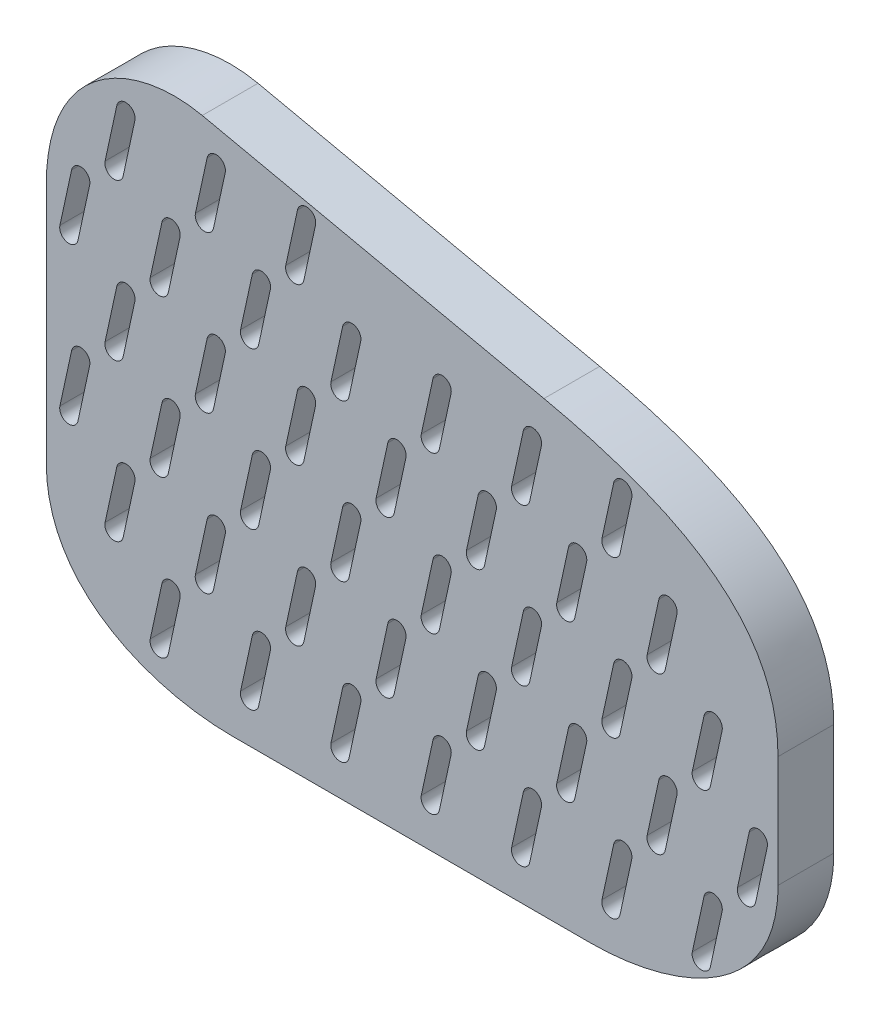
from build123d import *

# Parameters (mm, degrees)
EXTRUDE_1_DEPTH     = 10
CUT_EXTRUDE_1_DEPTH = 149.427210809
OTHER_1_DEPTH       = 10


# Read off the part's stored shape, not the designer's step: Образец заполнения1
with BuildPart() as part:
    # Эскиз1_fr → Бобышка-Вытянуть1 (new body)
    with BuildSketch(Plane.XY):
        with BuildLine():
            Line((0, 0), (0, 20))
            add(Edge.make_bspline(
                [(0, 20), (0, 38.146025899), (-14.209474182, 48.611098897), (-41.986949672, 54.649680525)],
                knots=[0, 0, 0, 0, 1, 1, 1, 1], degree=3))
            Line((-41.986949672, 54.649680525), (-103.301225383, 67.978870897))
            add(Edge.make_bspline(
                [(-103.301225383, 67.978870897), (-115.500001367, 70.63077872), (-131.292525164, 63.393306184), (-131.292525164, 43.097715536)],
                knots=[0, 0, 0, 0, 1, 1, 1, 1], degree=3))
            Line((-131.292525164, 43.097715536), (-131.292525164, 0))
            add(Edge.make_bspline(
                [(-97.969549234, -25.769768053), (-112.011160689, -25.769768053), (-131.292525164, -19.025155818), (-131.292525164, 0)],
                knots=[0, 0, 0, 0, 1, 1, 1, 1], degree=3))
            Line((-97.969549234, -25.769768053), (-33.545129103, -25.769768053))
            add(Edge.make_bspline(
                [(-33.545129103, -25.769768053), (-19.444866568, -25.769768053), (0, -19.063757455), (0, 0)],
                knots=[0, 0, 0, 0, 1, 1, 1, 1], degree=3))
        make_face()
    extrude(amount=EXTRUDE_1_DEPTH)

    # Эскиз2_fr → Вырез-Вытянуть1 (cut, through all)
    with BuildSketch(Plane(origin=(0, 0, 0), x_dir=(-1, 0, 0), z_dir=(0, 0, -1))):
        with BuildLine():
            Line((102.429251955, 61.832882372), (104.527789693, 52.179608775))
            ThreePointArc((104.527789693, 52.179608775), (103.259303337, 50.206407776), (101.286102339, 51.474894133))
            Line((101.286102339, 51.474894133), (99.1875646, 61.128167729))
            ThreePointArc((99.1875646, 61.128167729), (100.456050956, 63.101368728), (102.429251955, 61.832882372))
        make_face()
    extrude(amount=-CUT_EXTRUDE_1_DEPTH, mode=Mode.SUBTRACT)

    # Образец заполнения1 outline → Образец заполнения1 (cut)
    with BuildSketch(Plane.XY):
        with BuildLine():
            ThreePointArc((-120.737942491, 52.179608775), (-119.469456135, 50.206407776), (-117.496255136, 51.474894133))
            Line((-117.496255136, 51.474894133), (-115.397717398, 61.128167729))
            ThreePointArc((-115.397717398, 61.128167729), (-116.666203753, 63.101368728), (-118.639404752, 61.832882372))
            Line((-118.639404752, 61.832882372), (-120.737942491, 52.179608775))
        make_face()
        with BuildLine():
            ThreePointArc((-88.317636896, 52.179608775), (-87.04915054, 50.206407776), (-85.075949541, 51.474894133))
            Line((-85.075949541, 51.474894133), (-82.977411803, 61.128167729))
            ThreePointArc((-82.977411803, 61.128167729), (-84.245898159, 63.101368728), (-86.219099158, 61.832882372))
            Line((-86.219099158, 61.832882372), (-88.317636896, 52.179608775))
        make_face()
        with BuildLine():
            ThreePointArc((-128.84301889, 38.141204653), (-127.574532533, 36.168003655), (-125.601331535, 37.436490011))
            Line((-125.601331535, 37.436490011), (-123.502793796, 47.089763607))
            ThreePointArc((-123.502793796, 47.089763607), (-124.771280152, 49.062964606), (-126.744481151, 47.79447825))
            Line((-126.744481151, 47.79447825), (-128.84301889, 38.141204653))
        make_face()
        with BuildLine():
            ThreePointArc((-112.632866092, 38.141204653), (-111.364379735, 36.168003655), (-109.391178737, 37.436490011))
            Line((-109.391178737, 37.436490011), (-107.292640999, 47.089763607))
            ThreePointArc((-107.292640999, 47.089763607), (-108.561127355, 49.062964606), (-110.534328354, 47.79447825))
            Line((-110.534328354, 47.79447825), (-112.632866092, 38.141204653))
        make_face()
        with BuildLine():
            ThreePointArc((-96.422713295, 38.141204653), (-95.154226938, 36.168003655), (-93.18102594, 37.436490011))
            Line((-93.18102594, 37.436490011), (-91.082488201, 47.089763607))
            ThreePointArc((-91.082488201, 47.089763607), (-92.350974557, 49.062964606), (-94.324175556, 47.79447825))
            Line((-94.324175556, 47.79447825), (-96.422713295, 38.141204653))
        make_face()
        with BuildLine():
            ThreePointArc((-80.212560497, 38.141204653), (-78.94407414, 36.168003655), (-76.970873142, 37.436490011))
            Line((-76.970873142, 37.436490011), (-74.872335404, 47.089763607))
            ThreePointArc((-74.872335404, 47.089763607), (-76.14082176, 49.062964606), (-78.114022759, 47.79447825))
            Line((-78.114022759, 47.79447825), (-80.212560497, 38.141204653))
        make_face()
        with BuildLine():
            ThreePointArc((-64.0024077, 38.141204653), (-62.733921343, 36.168003655), (-60.760720345, 37.436490011))
            Line((-60.760720345, 37.436490011), (-58.662182607, 47.089763607))
            ThreePointArc((-58.662182607, 47.089763607), (-59.930668962, 49.062964606), (-61.903869961, 47.79447825))
            Line((-61.903869961, 47.79447825), (-64.0024077, 38.141204653))
        make_face()
        with BuildLine():
            ThreePointArc((-47.792254902, 38.141204653), (-46.523768545, 36.168003655), (-44.550567547, 37.436490011))
            Line((-44.550567547, 37.436490011), (-42.452029809, 47.089763607))
            ThreePointArc((-42.452029809, 47.089763607), (-43.720516165, 49.062964606), (-45.693717164, 47.79447825))
            Line((-45.693717164, 47.79447825), (-47.792254902, 38.141204653))
        make_face()
        with BuildLine():
            ThreePointArc((-120.737942491, 24.102800531), (-119.469456134, 22.129599533), (-117.496255136, 23.398085889))
            Line((-117.496255136, 23.398085889), (-115.397717398, 33.051359486))
            ThreePointArc((-115.397717398, 33.051359486), (-116.666203754, 35.024560484), (-118.639404752, 33.756074128))
            Line((-118.639404752, 33.756074128), (-120.737942491, 24.102800531))
        make_face()
        with BuildLine():
            ThreePointArc((-104.527789693, 24.102800531), (-103.259303337, 22.129599533), (-101.286102339, 23.398085889))
            Line((-101.286102339, 23.398085889), (-99.1875646, 33.051359486))
            ThreePointArc((-99.1875646, 33.051359486), (-100.456050957, 35.024560484), (-102.429251955, 33.756074128))
            Line((-102.429251955, 33.756074128), (-104.527789693, 24.102800531))
        make_face()
        with BuildLine():
            ThreePointArc((-88.317636896, 24.102800531), (-87.049150539, 22.129599533), (-85.075949541, 23.398085889))
            Line((-85.075949541, 23.398085889), (-82.977411803, 33.051359486))
            ThreePointArc((-82.977411803, 33.051359486), (-84.24589816, 35.024560484), (-86.219099158, 33.756074128))
            Line((-86.219099158, 33.756074128), (-88.317636896, 24.102800531))
        make_face()
        with BuildLine():
            ThreePointArc((-72.107484099, 24.102800531), (-70.838997742, 22.129599533), (-68.865796744, 23.398085889))
            Line((-68.865796744, 23.398085889), (-66.767259005, 33.051359486))
            ThreePointArc((-66.767259005, 33.051359486), (-68.035745362, 35.024560484), (-70.00894636, 33.756074128))
            Line((-70.00894636, 33.756074128), (-72.107484099, 24.102800531))
        make_face()
        with BuildLine():
            ThreePointArc((-55.897331301, 24.102800531), (-54.628844944, 22.129599533), (-52.655643946, 23.398085889))
            Line((-52.655643946, 23.398085889), (-50.557106208, 33.051359486))
            ThreePointArc((-50.557106208, 33.051359486), (-51.825592565, 35.024560484), (-53.798793563, 33.756074128))
            Line((-53.798793563, 33.756074128), (-55.897331301, 24.102800531))
        make_face()
        with BuildLine():
            ThreePointArc((-39.687178504, 24.102800531), (-38.418692147, 22.129599533), (-36.445491149, 23.398085889))
            Line((-36.445491149, 23.398085889), (-34.34695341, 33.051359486))
            ThreePointArc((-34.34695341, 33.051359486), (-35.615439767, 35.024560484), (-37.588640765, 33.756074128))
            Line((-37.588640765, 33.756074128), (-39.687178504, 24.102800531))
        make_face()
        with BuildLine():
            ThreePointArc((-31.582102105, 38.141204653), (-30.313615748, 36.168003655), (-28.34041475, 37.436490011))
            Line((-28.34041475, 37.436490011), (-26.241877012, 47.089763607))
            ThreePointArc((-26.241877012, 47.089763607), (-27.510363368, 49.062964606), (-29.483564367, 47.79447825))
            Line((-29.483564367, 47.79447825), (-31.582102105, 38.141204653))
        make_face()
        with BuildLine():
            ThreePointArc((-128.84301889, 10.06439641), (-127.574532534, 8.091195411), (-125.601331535, 9.359681767))
            Line((-125.601331535, 9.359681767), (-123.502793796, 19.012955364))
            ThreePointArc((-123.502793796, 19.012955364), (-124.771280153, 20.986156362), (-126.744481151, 19.717670006))
            Line((-126.744481151, 19.717670006), (-128.84301889, 10.06439641))
        make_face()
        with BuildLine():
            ThreePointArc((-112.632866092, 10.06439641), (-111.364379736, 8.091195411), (-109.391178737, 9.359681767))
            Line((-109.391178737, 9.359681767), (-107.292640999, 19.012955364))
            ThreePointArc((-107.292640999, 19.012955364), (-108.561127356, 20.986156362), (-110.534328354, 19.717670006))
            Line((-110.534328354, 19.717670006), (-112.632866092, 10.06439641))
        make_face()
        with BuildLine():
            ThreePointArc((-96.422713295, 10.06439641), (-95.154226939, 8.091195411), (-93.18102594, 9.359681767))
            Line((-93.18102594, 9.359681767), (-91.082488201, 19.012955364))
            ThreePointArc((-91.082488201, 19.012955364), (-92.350974558, 20.986156362), (-94.324175556, 19.717670006))
            Line((-94.324175556, 19.717670006), (-96.422713295, 10.06439641))
        make_face()
        with BuildLine():
            ThreePointArc((-80.212560497, 10.06439641), (-78.944074141, 8.091195411), (-76.970873142, 9.359681767))
            Line((-76.970873142, 9.359681767), (-74.872335404, 19.012955364))
            ThreePointArc((-74.872335404, 19.012955364), (-76.140821761, 20.986156362), (-78.114022759, 19.717670006))
            Line((-78.114022759, 19.717670006), (-80.212560497, 10.06439641))
        make_face()
        with BuildLine():
            ThreePointArc((-64.0024077, 10.06439641), (-62.733921344, 8.091195411), (-60.760720345, 9.359681767))
            Line((-60.760720345, 9.359681767), (-58.662182607, 19.012955364))
            ThreePointArc((-58.662182607, 19.012955364), (-59.930668963, 20.986156362), (-61.903869961, 19.717670006))
            Line((-61.903869961, 19.717670006), (-64.0024077, 10.06439641))
        make_face()
        with BuildLine():
            ThreePointArc((-47.792254902, 10.06439641), (-46.523768546, 8.091195411), (-44.550567547, 9.359681767))
            Line((-44.550567547, 9.359681767), (-42.452029809, 19.012955364))
            ThreePointArc((-42.452029809, 19.012955364), (-43.720516166, 20.986156362), (-45.693717164, 19.717670006))
            Line((-45.693717164, 19.717670006), (-47.792254902, 10.06439641))
        make_face()
        with BuildLine():
            ThreePointArc((-31.582102105, 10.06439641), (-30.313615749, 8.091195411), (-28.34041475, 9.359681767))
            Line((-28.34041475, 9.359681767), (-26.241877012, 19.012955364))
            ThreePointArc((-26.241877012, 19.012955364), (-27.510363369, 20.986156362), (-29.483564367, 19.717670006))
            Line((-29.483564367, 19.717670006), (-31.582102105, 10.06439641))
        make_face()
        with BuildLine():
            ThreePointArc((-23.477025706, 24.102800531), (-22.208539349, 22.129599533), (-20.235338351, 23.398085889))
            Line((-20.235338351, 23.398085889), (-18.136800613, 33.051359486))
            ThreePointArc((-18.136800613, 33.051359486), (-19.40528697, 35.024560484), (-21.378487968, 33.756074128))
            Line((-21.378487968, 33.756074128), (-23.477025706, 24.102800531))
        make_face()
        with BuildLine():
            ThreePointArc((-120.737942491, -3.974007712), (-119.469456135, -5.947208711), (-117.496255136, -4.678722355))
            Line((-117.496255136, -4.678722355), (-115.397717398, 4.974551242))
            ThreePointArc((-115.397717398, 4.974551242), (-116.666203754, 6.947752241), (-118.639404752, 5.679265884))
            Line((-118.639404752, 5.679265884), (-120.737942491, -3.974007712))
        make_face()
        with BuildLine():
            ThreePointArc((-104.527789693, -3.974007712), (-103.259303338, -5.947208711), (-101.286102339, -4.678722355))
            Line((-101.286102339, -4.678722355), (-99.1875646, 4.974551242))
            ThreePointArc((-99.1875646, 4.974551242), (-100.456050956, 6.947752241), (-102.429251955, 5.679265884))
            Line((-102.429251955, 5.679265884), (-104.527789693, -3.974007712))
        make_face()
        with BuildLine():
            ThreePointArc((-88.317636896, -3.974007712), (-87.04915054, -5.947208711), (-85.075949541, -4.678722355))
            Line((-85.075949541, -4.678722355), (-82.977411803, 4.974551242))
            ThreePointArc((-82.977411803, 4.974551242), (-84.245898159, 6.947752241), (-86.219099158, 5.679265884))
            Line((-86.219099158, 5.679265884), (-88.317636896, -3.974007712))
        make_face()
        with BuildLine():
            ThreePointArc((-72.107484099, -3.974007712), (-70.838997743, -5.947208711), (-68.865796744, -4.678722355))
            Line((-68.865796744, -4.678722355), (-66.767259005, 4.974551242))
            ThreePointArc((-66.767259005, 4.974551242), (-68.035745361, 6.947752241), (-70.00894636, 5.679265884))
            Line((-70.00894636, 5.679265884), (-72.107484099, -3.974007712))
        make_face()
        with BuildLine():
            ThreePointArc((-55.897331301, -3.974007712), (-54.628844945, -5.947208711), (-52.655643946, -4.678722355))
            Line((-52.655643946, -4.678722355), (-50.557106208, 4.974551242))
            ThreePointArc((-50.557106208, 4.974551242), (-51.825592564, 6.947752241), (-53.798793563, 5.679265884))
            Line((-53.798793563, 5.679265884), (-55.897331301, -3.974007712))
        make_face()
        with BuildLine():
            ThreePointArc((-39.687178504, -3.974007712), (-38.418692148, -5.947208711), (-36.445491149, -4.678722355))
            Line((-36.445491149, -4.678722355), (-34.34695341, 4.974551242))
            ThreePointArc((-34.34695341, 4.974551242), (-35.615439766, 6.947752241), (-37.588640765, 5.679265884))
            Line((-37.588640765, 5.679265884), (-39.687178504, -3.974007712))
        make_face()
        with BuildLine():
            ThreePointArc((-23.477025706, -3.974007712), (-22.20853935, -5.947208711), (-20.235338351, -4.678722355))
            Line((-20.235338351, -4.678722355), (-18.136800613, 4.974551242))
            ThreePointArc((-18.136800613, 4.974551242), (-19.405286969, 6.947752241), (-21.378487968, 5.679265884))
            Line((-21.378487968, 5.679265884), (-23.477025706, -3.974007712))
        make_face()
        with BuildLine():
            ThreePointArc((-15.371949307, 10.06439641), (-14.103462952, 8.091195411), (-12.130261953, 9.359681767))
            Line((-12.130261953, 9.359681767), (-10.031724214, 19.012955364))
            ThreePointArc((-10.031724214, 19.012955364), (-11.300210571, 20.986156362), (-13.273411569, 19.717670006))
            Line((-13.273411569, 19.717670006), (-15.371949307, 10.06439641))
        make_face()
        with BuildLine():
            ThreePointArc((-112.632866092, -18.012411834), (-111.364379736, -19.985612833), (-109.391178737, -18.717126476))
            Line((-109.391178737, -18.717126476), (-107.292640999, -9.06385288))
            ThreePointArc((-107.292640999, -9.06385288), (-108.561127355, -7.090651881), (-110.534328354, -8.359138237))
            Line((-110.534328354, -8.359138237), (-112.632866092, -18.012411834))
        make_face()
        with BuildLine():
            ThreePointArc((-96.422713295, -18.012411834), (-95.154226939, -19.985612833), (-93.18102594, -18.717126476))
            Line((-93.18102594, -18.717126476), (-91.082488201, -9.06385288))
            ThreePointArc((-91.082488201, -9.06385288), (-92.350974557, -7.090651881), (-94.324175556, -8.359138237))
            Line((-94.324175556, -8.359138237), (-96.422713295, -18.012411834))
        make_face()
        with BuildLine():
            ThreePointArc((-80.212560497, -18.012411834), (-78.944074141, -19.985612833), (-76.970873142, -18.717126476))
            Line((-76.970873142, -18.717126476), (-74.872335404, -9.06385288))
            ThreePointArc((-74.872335404, -9.06385288), (-76.14082176, -7.090651881), (-78.114022759, -8.359138237))
            Line((-78.114022759, -8.359138237), (-80.212560497, -18.012411834))
        make_face()
        with BuildLine():
            ThreePointArc((-64.0024077, -18.012411834), (-62.733921344, -19.985612833), (-60.760720345, -18.717126476))
            Line((-60.760720345, -18.717126476), (-58.662182607, -9.06385288))
            ThreePointArc((-58.662182607, -9.06385288), (-59.930668962, -7.090651881), (-61.903869961, -8.359138237))
            Line((-61.903869961, -8.359138237), (-64.0024077, -18.012411834))
        make_face()
        with BuildLine():
            ThreePointArc((-47.792254902, -18.012411834), (-46.523768546, -19.985612833), (-44.550567547, -18.717126476))
            Line((-44.550567547, -18.717126476), (-42.452029809, -9.06385288))
            ThreePointArc((-42.452029809, -9.06385288), (-43.720516165, -7.090651881), (-45.693717164, -8.359138237))
            Line((-45.693717164, -8.359138237), (-47.792254902, -18.012411834))
        make_face()
        with BuildLine():
            ThreePointArc((-31.582102105, -18.012411834), (-30.313615749, -19.985612833), (-28.34041475, -18.717126476))
            Line((-28.34041475, -18.717126476), (-26.241877012, -9.06385288))
            ThreePointArc((-26.241877012, -9.06385288), (-27.510363368, -7.090651881), (-29.483564367, -8.359138237))
            Line((-29.483564367, -8.359138237), (-31.582102105, -18.012411834))
        make_face()
        with BuildLine():
            ThreePointArc((-15.371949307, -18.012411834), (-14.103462951, -19.985612833), (-12.130261953, -18.717126476))
            Line((-12.130261953, -18.717126476), (-10.031724214, -9.06385288))
            ThreePointArc((-10.031724214, -9.06385288), (-11.30021057, -7.090651881), (-13.273411569, -8.359138237))
            Line((-13.273411569, -8.359138237), (-15.371949307, -18.012411834))
        make_face()
        with BuildLine():
            ThreePointArc((-1.926647815, 4.974551242), (-3.195134171, 6.947752241), (-5.16833517, 5.679265884))
            Line((-5.16833517, 5.679265884), (-7.266872909, -3.974007712))
            ThreePointArc((-7.266872909, -3.974007712), (-5.998386553, -5.947208711), (-4.025185554, -4.678722355))
            Line((-4.025185554, -4.678722355), (-1.926647815, 4.974551242))
        make_face()
    extrude(amount=OTHER_1_DEPTH, mode=Mode.SUBTRACT)


solid = part.part
